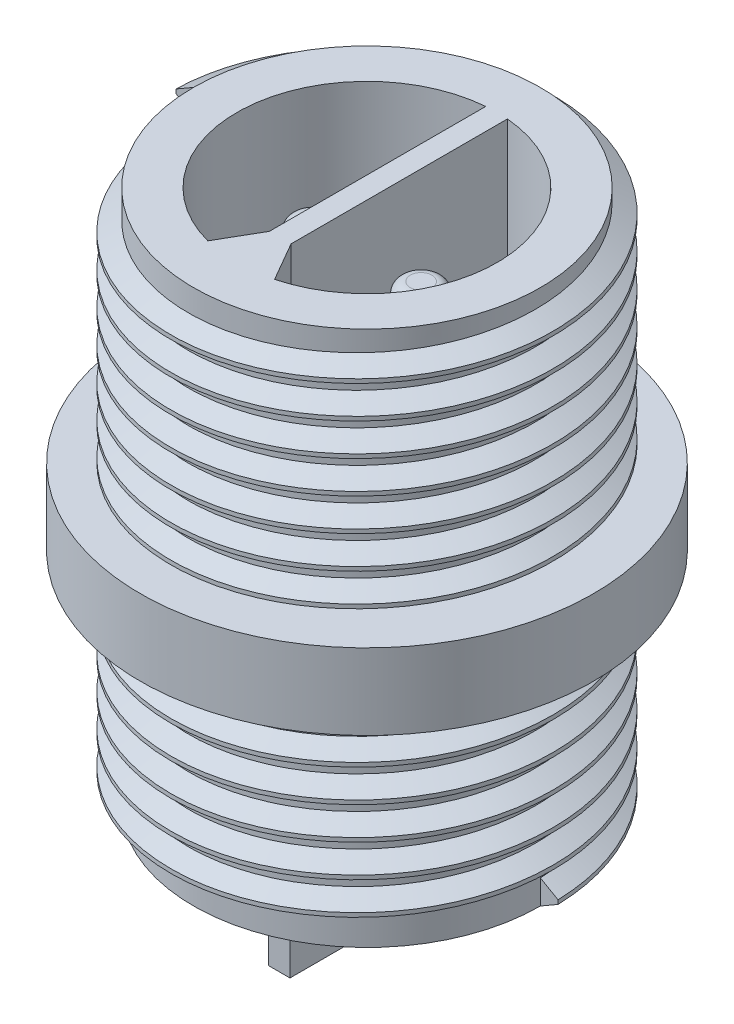
from build123d import *

# Parameters (mm, degrees)
CUT_EXTRUDE1_DEPTH    = 7
SKETCH3_W             = 1
SKETCH3_H             = 8.1
BOSS_EXTRUDE1_DEPTH   = 4.6
SKETCH4_R             = 1
BOSS_EXTRUDE2_DEPTH   = 2.5
BOSS_EXTRUDE2_2_DEPTH = 2.5
SKETCH5_R             = 1
BOSS_EXTRUDE3_DEPTH   = 4.5
BOSS_EXTRUDE3_2_DEPTH = 4.5
FILLET2_R             = 0.5
FILLET3_R             = 0.5
THREAD1_PITCH         = 1.5
THREAD2_PITCH         = 1.5


with BuildPart() as part:
    # Sketch1 → Revolve1 (revolve)
    with BuildSketch(Plane.XY, mode=Mode.PRIVATE) as revolve1_sk:
        Polygon((0, 0), (8, 0), (8, 10.2), (10.45, 10.2), (10.45, 13.7), (8, 13.7), (8, 24.7), (0, 24.7), align=None)
    revolve(revolve1_sk.sketch.rotate(Axis((0, 0, 0), (0, 1, 0)), 90), axis=Axis((0, 0, 0), (0, 1, 0)))

    # Sketch2 → Cut-Extrude1 (cut)
    with BuildSketch(Plane(origin=(0, 24.7, 0), x_dir=(1, 0, 0), z_dir=(0, 1, 0))):
        with BuildLine():
            Line((-0.5, -4), (-0.5, 5.979130372))
            ThreePointArc((-0.5, 5.979130372), (-5.976798736, 0.527140275), (-1.538832081, -5.799309944))
            Line((-1.538832081, -5.799309944), (-0.5, -4))
        make_face()
        with BuildLine():
            ThreePointArc((6, 0), (4.415880433, 4.062019202), (0.5, 5.979130372))
            Line((0.5, 5.979130372), (0.5, -4))
            Line((0.5, -4), (1.538832081, -5.799309944))
            ThreePointArc((1.538832081, -5.799309944), (4.755680418, -3.658347135), (6, 0))
        make_face()
    extrude(amount=-CUT_EXTRUDE1_DEPTH, mode=Mode.SUBTRACT)

    # Sketch3 → Boss-Extrude1 (add)
    with BuildSketch(Plane.XZ):
        Rectangle(SKETCH3_W, SKETCH3_H)
    extrude(amount=BOSS_EXTRUDE1_DEPTH)

    # Thread1: the profile of Thread Profile2 profile screwed along a right-hand helix of 7.333333 turns, 8 arcs to a turn; built about Z, then put on its axis
    thread1_z = Axis((0, 0, 0), (0, 0, 1))
    thread1_corners = [(7.9997, 0, -0.000173205), (8.811898813, 0, 0.468749998), (8.811898813, 0, 0.656249998), (7.9997, 0, 1.125173201)]
    with BuildLine(mode=Mode.PRIVATE) as thread1_profile:
        Line(thread1_corners[0], thread1_corners[1])
        Line(thread1_corners[1], thread1_corners[2])
        Line(thread1_corners[2], thread1_corners[3])
        Line(thread1_corners[3], thread1_corners[0])
    thread1_cap = Face(thread1_profile.wire())
    thread1_turn_angles = [0, 22.5, 45, 67.5, 90, 112.5, 135, 157.5, 180, 202.5, 225, 247.5, 270, 292.5, 315, 337.5, 360]
    thread1_turn_weights = [1, 0.9238795325112867, 1, 0.9238795325112867, 1, 0.9238795325112867, 1, 0.9238795325112867, 1, 0.9238795325112867, 1, 0.9238795325112867, 1, 0.9238795325112867, 1, 0.9238795325112867, 1]
    thread1_turn_rails = [Edge.make_bspline([Vector(p[0], p[1], 0).rotate(thread1_z, thread1_turn_angles[k]) / thread1_turn_weights[k] + Vector(0, 0, p[2] + THREAD1_PITCH * thread1_turn_angles[k] / 360) for k in range(17)], [0, 0, 0, 1, 1, 2, 2, 3, 3, 4, 4, 5, 5, 6, 6, 7, 7, 8, 8, 8], 2, thread1_turn_weights) for p in thread1_corners]
    thread1_turn_sides = [Face.make_surface_from_curves(thread1_turn_rails[p[0]], thread1_turn_rails[p[1]]) for p in [(0, 1), (1, 2), (2, 3), (3, 0)]]
    thread1_last_angles = [2520, 2542.5, 2565, 2587.5, 2610, 2625, 2640]
    thread1_last_weights = [1, 0.9238795325112867, 1, 0.9238795325112867, 1, 0.9659258262890703, 1]
    thread1_last_rails = [Edge.make_bspline([Vector(p[0], p[1], 0).rotate(thread1_z, thread1_last_angles[k]) / thread1_last_weights[k] + Vector(0, 0, p[2] + THREAD1_PITCH * thread1_last_angles[k] / 360) for k in range(7)], [0, 0, 0, 1, 1, 2, 2, 3, 3, 3], 2, thread1_last_weights) for p in thread1_corners]
    thread1_last_sides = [Face.make_surface_from_curves(thread1_last_rails[p[0]], thread1_last_rails[p[1]]) for p in [(0, 1), (1, 2), (2, 3), (3, 0)]]
    thread1 = Plane(origin=(0, 24.7, 0), x_dir=(-1, 0, 0), z_dir=(0, -1, 0)) * Solid(Shell([*[p.moved(Location((0, 0, THREAD1_PITCH * i))) for i in range(7) for p in thread1_turn_sides], *thread1_last_sides, thread1_cap, thread1_cap.rotate(thread1_z, 2640).moved(Location((0, 0, THREAD1_PITCH * 2640 / 360)))]))
    add(thread1)

    # Thread2: the profile of Thread Profile3 profile screwed along a right-hand helix of 6.8 turns, 8 arcs to a turn; built about Z, then put on its axis
    thread2_z = Axis((0, 0, 0), (0, 0, 1))
    thread2_corners = [(7.9997, 0, -0.000173205), (8.811898813, 0, 0.468749998), (8.811898813, 0, 0.656249998), (7.9997, 0, 1.125173201)]
    with BuildLine(mode=Mode.PRIVATE) as thread2_profile:
        Line(thread2_corners[0], thread2_corners[1])
        Line(thread2_corners[1], thread2_corners[2])
        Line(thread2_corners[2], thread2_corners[3])
        Line(thread2_corners[3], thread2_corners[0])
    thread2_cap = Face(thread2_profile.wire())
    thread2_turn_angles = [0, 22.5, 45, 67.5, 90, 112.5, 135, 157.5, 180, 202.5, 225, 247.5, 270, 292.5, 315, 337.5, 360]
    thread2_turn_weights = [1, 0.9238795325112867, 1, 0.9238795325112867, 1, 0.9238795325112867, 1, 0.9238795325112867, 1, 0.9238795325112867, 1, 0.9238795325112867, 1, 0.9238795325112867, 1, 0.9238795325112867, 1]
    thread2_turn_rails = [Edge.make_bspline([Vector(p[0], p[1], 0).rotate(thread2_z, thread2_turn_angles[k]) / thread2_turn_weights[k] + Vector(0, 0, p[2] + THREAD2_PITCH * thread2_turn_angles[k] / 360) for k in range(17)], [0, 0, 0, 1, 1, 2, 2, 3, 3, 4, 4, 5, 5, 6, 6, 7, 7, 8, 8, 8], 2, thread2_turn_weights) for p in thread2_corners]
    thread2_turn_sides = [Face.make_surface_from_curves(thread2_turn_rails[p[0]], thread2_turn_rails[p[1]]) for p in [(0, 1), (1, 2), (2, 3), (3, 0)]]
    thread2_last_angles = [2160, 2182.5, 2205, 2227.5, 2250, 2272.5, 2295, 2317.5, 2340, 2362.5, 2385, 2407.5, 2430, 2439, 2448]
    thread2_last_weights = [1, 0.9238795325112867, 1, 0.9238795325112867, 1, 0.9238795325112867, 1, 0.9238795325112867, 1, 0.9238795325112867, 1, 0.9238795325112867, 1, 0.9876883405951383, 1]
    thread2_last_rails = [Edge.make_bspline([Vector(p[0], p[1], 0).rotate(thread2_z, thread2_last_angles[k]) / thread2_last_weights[k] + Vector(0, 0, p[2] + THREAD2_PITCH * thread2_last_angles[k] / 360) for k in range(15)], [0, 0, 0, 1, 1, 2, 2, 3, 3, 4, 4, 5, 5, 6, 6, 7, 7, 7], 2, thread2_last_weights) for p in thread2_corners]
    thread2_last_sides = [Face.make_surface_from_curves(thread2_last_rails[p[0]], thread2_last_rails[p[1]]) for p in [(0, 1), (1, 2), (2, 3), (3, 0)]]
    thread2 = Plane(origin=(0, 0, 0), x_dir=(1, 0, 0), z_dir=(0, 1, 0)) * Solid(Shell([*[p.moved(Location((0, 0, THREAD2_PITCH * i))) for i in range(6) for p in thread2_turn_sides], *thread2_last_sides, thread2_cap, thread2_cap.rotate(thread2_z, 2448).moved(Location((0, 0, THREAD2_PITCH * 2448 / 360)))]))
    add(thread2)


with BuildPart() as body_2:
    # Sketch4 → Boss-Extrude2 (new body)
    with BuildSketch(Plane.XZ):
        with Locations(Location((-2.5, 0, 0), (0, 0, 270))):
            Circle(SKETCH4_R)
    extrude(amount=BOSS_EXTRUDE2_DEPTH)


with BuildPart() as body_3:
    # Sketch4 → Boss-Extrude2 2 (new body)
    with BuildSketch(Plane.XZ):
        with Locations(Location((2.5, 0, 0), (0, 0, 270))):
            Circle(SKETCH4_R)
    extrude(amount=BOSS_EXTRUDE2_2_DEPTH)


with BuildPart() as body_4:
    # Sketch5 → Boss-Extrude3 (new body)
    with BuildSketch(Plane(origin=(0, 17.7, 0), x_dir=(1, 0, 0), z_dir=(0, 1, 0))):
        with Locations(Location((2.5, 0, 0), (0, 0, 270))):
            Circle(SKETCH5_R)
    extrude(amount=BOSS_EXTRUDE3_DEPTH)

    # Fillet3
    fillet3_edges = [body_4.edges().sort_by_distance(p)[0] for p in [
        (2.5, 22.2, -1),
    ]]
    fillet(fillet3_edges, radius=FILLET3_R)


with BuildPart() as body_5:
    # Sketch5 → Boss-Extrude3 2 (new body)
    with BuildSketch(Plane(origin=(0, 17.7, 0), x_dir=(1, 0, 0), z_dir=(0, 1, 0))):
        with Locations(Location((-2.5, 0, 0), (0, 0, 270))):
            Circle(SKETCH5_R)
    extrude(amount=BOSS_EXTRUDE3_2_DEPTH)

    # Fillet2
    fillet2_edges = [body_5.edges().sort_by_distance(p)[0] for p in [
        (-2.5, 22.2, -1),
    ]]
    fillet(fillet2_edges, radius=FILLET2_R)


solid = Compound([part.part, body_2.part, body_3.part, body_4.part, body_5.part])
